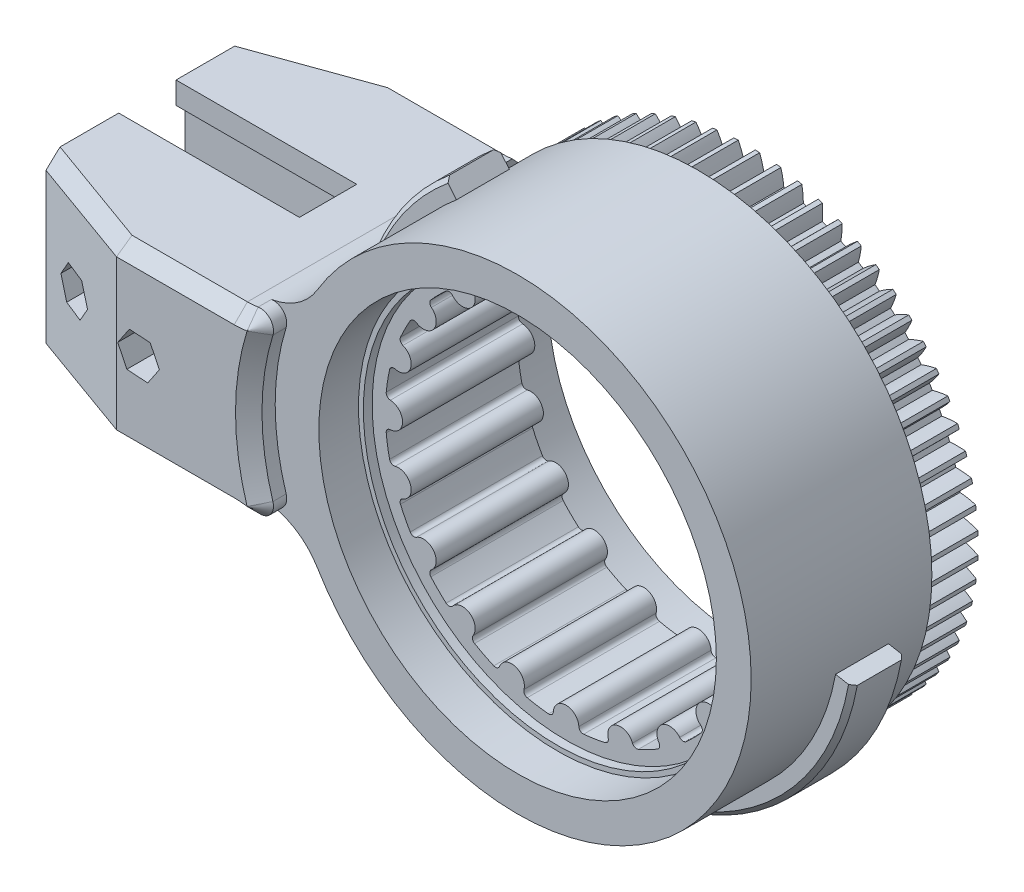
from build123d import *

# Parameters (mm, degrees)
SKETCH1_R            = 53
BOSS_EXTRUDE1_DEPTH  = 30
BOSS_EXTRUDE2_DEPTH  = 30
BOSS_EXTRUDE3_DEPTH  = 17
BOSS_EXTRUDE4_START  = 17
BOSS_EXTRUDE4_DEPTH  = 17
SKETCH7_W            = 82
SKETCH7_H            = 12.999999999999998
CUT_EXTRUDE3_DEPTH   = 141.13564856952
CUT_EXTRUDE4_DEPTH   = 141.13564856952
FILLET3_R            = 15
CUT_EXTRUDE5_DEPTH   = 41
SKETCH11_R           = 2.750000000000008
CUT_EXTRUDE6_DEPTH   = 138.85862323409444
SKETCH12_R           = 4.599999999999999
SKETCH12_R_2         = 4.600000000000013
CUT_EXTRUDE7_DEPTH   = 12
CUT_EXTRUDE8_DEPTH   = 12
FILLET5_R            = 3
SKETCH25_R           = 57.000000000000014
SKETCH25_R_2         = 53.00000000000001
BOSS_EXTRUDE8_DEPTH  = 6
CUT_EXTRUDE12_START  = -15
CUT_EXTRUDE12_DEPTH  = 15
CHAMFER4_SIZE        = 1
CUT_EXTRUDE13_DEPTH  = 133.5066036875144
FILLET6_R            = 1
BOSS_EXTRUDE9_DEPTH  = 17
SKETCH29_R           = 53.00000000000001
SKETCH29_R_2         = 44
BOSS_EXTRUDE10_DEPTH = 11
SKETCH30_R           = 45.1
CUT_EXTRUDE14_DEPTH  = 9
BOSS_EXTRUDE12_START = 11
SKETCH31_R           = 44
BOSS_EXTRUDE12_DEPTH = 11
CUT_EXTRUDE15_START  = -9
SKETCH32_R           = 45.1
CUT_EXTRUDE15_DEPTH  = 9
CUT_EXTRUDE16_DEPTH  = 87.00000000000003
CUT_EXTRUDE17_DEPTH  = 11
CHAMFER5_SIZE        = 3
CUT_EXTRUDE18_START  = -6
CUT_EXTRUDE18_DEPTH  = 6


# Read off the part's stored shape, not the designer's step: Cut-Extrude18
# Some blends are built 0.0001 mm under size
with BuildPart() as part:
    # Sketch1 → Boss-Extrude1 (new body)
    with BuildSketch(Plane.XY):
        Circle(SKETCH1_R)
    extrude(amount=BOSS_EXTRUDE1_DEPTH)

    # Sketch4 → Boss-Extrude2 (add)
    with BuildSketch(Plane(origin=(0, 0, 0), x_dir=(-1, 0, 0), z_dir=(0, 0, -1))):
        with BuildLine():
            Line((49.081564767232116, -19.999999999999993), (110, -19.999999999999993))
            Line((110, -19.999999999999993), (110, 20.000000000000007))
            Line((110, 20.000000000000007), (49.08156476723211, 20.000000000000007))
            ThreePointArc((49.08156476723211, 20.000000000000007), (53.00000000000001, 8.83e-15), (49.081564767232116, -19.999999999999993))
        make_face()
    extrude(amount=-BOSS_EXTRUDE2_DEPTH)

    # Sketch5 → Boss-Extrude3 (add)
    with BuildSketch(Plane(origin=(0, 0, 0), x_dir=(-1, 0, 0), z_dir=(0, 0, -1))):
        with BuildLine():
            Line((110, -20), (110, 20))
            Line((110, 20), (51.234753829797995, 20))
            ThreePointArc((51.234753829797995, 20), (55, 0), (51.234753829797995, -20))
            Line((51.234753829797995, -20), (110, -20))
        make_face()
    extrude(amount=BOSS_EXTRUDE3_DEPTH)

    # Sketch6 → Boss-Extrude4 (add)
    with BuildSketch(Plane.XY.offset(30).offset(BOSS_EXTRUDE4_START)):
        with BuildLine():
            Line((-110, -20), (-51.234753829797995, -20))
            ThreePointArc((-51.234753829797995, -20), (-54.99999999999999, 6.74e-15), (-51.23475382979798, 20.00000000000001))
            Line((-51.23475382979798, 20.00000000000001), (-110.00000000000001, 20))
            Line((-110.00000000000001, 20), (-110, -20))
        make_face()
    extrude(amount=-BOSS_EXTRUDE4_DEPTH)

    # Sketch7 → Cut-Extrude3 (cut, through all)
    with BuildSketch(Plane(origin=(0, 20.000000000000007, 0), x_dir=(1, -1.3e-16, 0), z_dir=(1.3e-16, 1, 0))):
        with Locations((-110, -15)):
            Rectangle(SKETCH7_W, SKETCH7_H)
    extrude(amount=-CUT_EXTRUDE3_DEPTH, mode=Mode.SUBTRACT)

    # Sketch8 → Cut-Extrude4 (cut, through all)
    with BuildSketch(Plane(origin=(0, 20.000000000000007, 0), x_dir=(1, -1.3e-16, 0), z_dir=(1.3e-16, 1, 0))):
        Polygon((-110, 7.999999999999993), (-84.99999999999999, 16.999999999999996), (-110, 17), align=None)
        Polygon((-110.00000000000001, -38), (-85.00000000000001, -47), (-110.00000000000001, -47), align=None)
    extrude(amount=-CUT_EXTRUDE4_DEPTH, mode=Mode.SUBTRACT)

    # Fillet3
    # the kernel refuses this fillet: 15 mm, written as the material it adds along each edge
    with BuildSketch(Plane(origin=(-49.0815647672321, 20.000000000000014, -23.048446553404), x_dir=(0.4473529357802653, 0.8943575072915626, 0), z_dir=(0, 0, 1))) as fillet3_piece_1_section:
        with BuildLine():
            CenterArc((9.291046517037513, 14.955714519282), FILLET3_R, 206.57397747208606, 59.02220221936807)
            Line((-4.1243160923359525, 8.245420482578071), (0, 0))
            ThreePointArc((0, 0), (4.0696319454792445, 0.15647536520358749), (8.139263890958485, 1e-16))
        make_face()
    fillet3_piece_1 = extrude(amount=53.048446553404, mode=Mode.PRIVATE)
    fillet3_piece_1 = split(fillet3_piece_1, bisect_by=Plane(origin=(-53.28116974823122, 20.422092874134577, 0), z_dir=(0, 0, -1)), keep=Keep.TOP, mode=Mode.PRIVATE)
    fillet3_piece_1 = split(fillet3_piece_1, bisect_by=Plane(origin=(-53.28116974823122, 20.422092874134577, -17), z_dir=(0, 0, 1)), keep=Keep.TOP, mode=Mode.PRIVATE)
    fillet3_piece_1 = fillet3_piece_1 - Plane(origin=(-4.619e-14, -8.9e-16, -8.500000000001432), x_dir=(-0.9315409787235998, 0.36363636363636387, 0), z_dir=(0, 0, 1)) * Cylinder(54.999999999999964, 140, mode=Mode.PRIVATE)
    add(fillet3_piece_1)
    with BuildSketch(Plane(origin=(-49.0815647672321, 20.000000000000004, 0), x_dir=(0.4473529357802649, 0.8943575072915632, 0), z_dir=(0, 0, 1))) as fillet3_piece_2_section:
        with BuildLine():
            CenterArc((9.291046517037534, 14.955714519282003), FILLET3_R, 206.57397747208603, 59.02220221936807)
            Line((-4.124316092335939, 8.245420482578082), (0, 0))
            ThreePointArc((0, 0), (4.069631945479255, 0.15647536520358993), (8.139263890958498, -1.8e-16))
        make_face()
    fillet3_piece_2 = extrude(amount=30, mode=Mode.PRIVATE)
    fillet3_piece_2 = fillet3_piece_2 & Plane(origin=(-4.619e-14, -8.9e-16, 15.000000000000005), x_dir=(-0.9315409787235998, 0.36363636363636387, 0), z_dir=(0, 0, 1)) * Cylinder(54.999999999999964, 93, mode=Mode.PRIVATE)
    add(fillet3_piece_2)
    with BuildSketch(Plane(origin=(-49.0815647672321, 20.000000000000004, 0), x_dir=(0.4473529357802649, 0.8943575072915632, 0), z_dir=(0, 0, 1))) as fillet3_piece_3_section:
        with BuildLine():
            CenterArc((9.291046517037534, 14.955714519282003), FILLET3_R, 206.57397747208603, 59.02220221936807)
            Line((-4.124316092335939, 8.245420482578082), (0, 0))
            ThreePointArc((0, 0), (4.069631945479255, 0.15647536520358993), (8.139263890958498, -1.8e-16))
        make_face()
    fillet3_piece_3 = extrude(amount=30, mode=Mode.PRIVATE)
    fillet3_piece_3 = fillet3_piece_3 - Plane(origin=(-4.619e-14, -8.9e-16, 15), x_dir=(-0.9315409787235998, 0.36363636363636387, 0), z_dir=(0, 0, 1)) * Cylinder(54.999999999999964, 93, mode=Mode.PRIVATE)
    add(fillet3_piece_3)
    with BuildSketch(Plane(origin=(-49.0815647672321, 20.000000000000004, 0), x_dir=(0.4473529357802649, 0.8943575072915632, 0), z_dir=(0, 0, 1))) as fillet3_piece_4_section:
        with BuildLine():
            CenterArc((9.291046517037534, 14.955714519282003), FILLET3_R, 206.57397747208603, 59.02220221936807)
            Line((-4.124316092335939, 8.245420482578082), (0, 0))
            ThreePointArc((0, 0), (4.069631945479255, 0.15647536520358993), (8.139263890958498, -1.8e-16))
        make_face()
    fillet3_piece_4 = extrude(amount=53.04844655340399, mode=Mode.PRIVATE)
    fillet3_piece_4 = split(fillet3_piece_4, bisect_by=Plane(origin=(-53.28116974823098, 20.422092874134677, 30), z_dir=(0, 0, 1)), keep=Keep.TOP, mode=Mode.PRIVATE)
    fillet3_piece_4 = split(fillet3_piece_4, bisect_by=Plane(origin=(-53.28116974823098, 20.422092874134677, 47), z_dir=(0, 0, -1)), keep=Keep.TOP, mode=Mode.PRIVATE)
    fillet3_piece_4 = fillet3_piece_4 - Plane(origin=(-4.619e-14, -8.9e-16, 38.5), x_dir=(-0.9315409787235998, 0.36363636363636387, 0), z_dir=(0, 0, 1)) * Cylinder(54.999999999999964, 140, mode=Mode.PRIVATE)
    add(fillet3_piece_4)
    with BuildSketch(Plane(origin=(-49.0815647672321, -20, -23.048446553404016), x_dir=(0.44735293578026375, -0.8943575072915635, 0), z_dir=(0, 0, 1))) as fillet3_piece_5_section:
        with BuildLine():
            CenterArc((9.291046517037518, -14.955714519281996), FILLET3_R, 94.40382030854599, 59.022202219367955)
            Line((-4.12431609233595, -8.245420482578071), (0, 0))
            ThreePointArc((0, 0), (4.06963194547922, -0.15647536520359132), (8.139263890958468, 4.4e-16))
        make_face()
    fillet3_piece_5 = extrude(amount=53.04844655340402, mode=Mode.PRIVATE)
    fillet3_piece_5 = split(fillet3_piece_5, bisect_by=Plane(origin=(-53.281169748231235, -20.422092874134563, 0), z_dir=(0, 0, -1)), keep=Keep.TOP, mode=Mode.PRIVATE)
    fillet3_piece_5 = fillet3_piece_5 - Plane(origin=(-4.619e-14, -8.9e-16, -8.50000000000143), x_dir=(-0.9315409787235998, 0.36363636363636387, 0), z_dir=(0, 0, 1)) * Cylinder(54.999999999999964, 140, mode=Mode.PRIVATE)
    fillet3_piece_5 = split(fillet3_piece_5, bisect_by=Plane(origin=(-53.281169748231235, -20.422092874134563, -17), z_dir=(0, 0, 1)), keep=Keep.TOP, mode=Mode.PRIVATE)
    add(fillet3_piece_5)
    with BuildSketch(Plane(origin=(-49.08156476723211, -19.999999999999993, 0), x_dir=(0.44735293578026414, -0.8943575072915634, 0), z_dir=(0, 0, 1))) as fillet3_piece_6_section:
        with BuildLine():
            CenterArc((9.291046517037522, -14.955714519281997), FILLET3_R, 94.40382030854596, 59.02220221936801)
            Line((-4.124316092335951, -8.24542048257808), (0, 0))
            ThreePointArc((0, 0), (4.069631945479229, -0.15647536520358973), (8.139263890958478, 2.1e-16))
        make_face()
    fillet3_piece_6 = extrude(amount=30, mode=Mode.PRIVATE)
    fillet3_piece_6 = fillet3_piece_6 & Plane(origin=(-4.619e-14, -8.9e-16, 15.000000000000002), x_dir=(-0.9315409787235998, 0.36363636363636387, 0), z_dir=(0, 0, 1)) * Cylinder(54.999999999999964, 93, mode=Mode.PRIVATE)
    add(fillet3_piece_6)
    with BuildSketch(Plane(origin=(-49.08156476723211, -19.999999999999993, 0), x_dir=(0.44735293578026414, -0.8943575072915634, 0), z_dir=(0, 0, 1))) as fillet3_piece_7_section:
        with BuildLine():
            CenterArc((9.291046517037522, -14.955714519281997), FILLET3_R, 94.40382030854596, 59.02220221936801)
            Line((-4.124316092335951, -8.24542048257808), (0, 0))
            ThreePointArc((0, 0), (4.069631945479229, -0.15647536520358973), (8.139263890958478, 2.1e-16))
        make_face()
    fillet3_piece_7 = extrude(amount=30, mode=Mode.PRIVATE)
    fillet3_piece_7 = fillet3_piece_7 - Plane(origin=(-4.619e-14, -8.9e-16, 15.000000000000004), x_dir=(-0.9315409787235998, 0.36363636363636387, 0), z_dir=(0, 0, 1)) * Cylinder(54.999999999999964, 93, mode=Mode.PRIVATE)
    add(fillet3_piece_7)
    with BuildSketch(Plane(origin=(-49.08156476723211, -19.999999999999993, 0), x_dir=(0.44735293578026414, -0.8943575072915634, 0), z_dir=(0, 0, 1))) as fillet3_piece_8_section:
        with BuildLine():
            CenterArc((9.291046517037522, -14.955714519281997), FILLET3_R, 94.40382030854596, 59.02220221936801)
            Line((-4.124316092335951, -8.24542048257808), (0, 0))
            ThreePointArc((0, 0), (4.069631945479229, -0.15647536520358973), (8.139263890958478, 2.1e-16))
        make_face()
    fillet3_piece_8 = extrude(amount=53.04844655340402, mode=Mode.PRIVATE)
    fillet3_piece_8 = split(fillet3_piece_8, bisect_by=Plane(origin=(-53.281169748231, -20.422092874134673, 30), z_dir=(0, 0, 1)), keep=Keep.TOP, mode=Mode.PRIVATE)
    fillet3_piece_8 = fillet3_piece_8 - Plane(origin=(-4.619e-14, -8.9e-16, 38.50000000000001), x_dir=(-0.9315409787235998, 0.36363636363636387, 0), z_dir=(0, 0, 1)) * Cylinder(54.999999999999964, 140, mode=Mode.PRIVATE)
    fillet3_piece_8 = split(fillet3_piece_8, bisect_by=Plane(origin=(-53.281169748231, -20.422092874134673, 47), z_dir=(0, 0, -1)), keep=Keep.TOP, mode=Mode.PRIVATE)
    add(fillet3_piece_8)

    # Sketch10 → Cut-Extrude5 (cut)
    with BuildSketch(Plane.ZY.offset(110)):
        Polygon((6.500000000000009, 15.000000000000007), (23.499999999999993, 15.000000000000005), (23.499999999999993, -14.999999999999998), (6.500000000000009, -14.999999999999995), align=None)
    extrude(amount=-CUT_EXTRUDE5_DEPTH, mode=Mode.SUBTRACT)

    # Sketch11 → Cut-Extrude6 (cut, through all)
    with BuildSketch(Plane(origin=(0, 0, -17), x_dir=(-1, 0, 0), z_dir=(0, 0, -1))):
        with Locations((100.00000000000001, -3.67e-15)):
            Circle(SKETCH11_R)
        with Locations((80.00000000000001, -6.12e-15)):
            Circle(SKETCH11_R)
    extrude(amount=-CUT_EXTRUDE6_DEPTH, mode=Mode.SUBTRACT)

    # Sketch12 → Cut-Extrude7 (cut)
    with BuildSketch(Plane(origin=(0, 0, -17), x_dir=(-1, 0, 0), z_dir=(0, 0, -1))):
        with Locations((80.00000000000001, -6.12e-15)):
            Circle(SKETCH12_R)
        with Locations((100.00000000000001, -3.67e-15)):
            Circle(SKETCH12_R_2)
    extrude(amount=-CUT_EXTRUDE7_DEPTH, mode=Mode.SUBTRACT)

    # Sketch13 → Cut-Extrude8 (cut)
    with BuildSketch(Plane.XY.offset(47)):
        Polygon((-104.72243583501142, 0.3345640708945011), (-102.6509589020939, -3.9224673654145996), (-97.92852306708248, -4.25703143630911), (-95.2775641649886, -0.33456407089451756), (-97.34904109790612, 3.922467365414598), (-102.07147693291755, 4.257031436309093), align=None)
        Polygon((-84.72243583501141, 0.3345640708945193), (-82.6509589020939, -3.9224673654145708), (-77.92852306708252, -4.257031436309093), (-75.27756416498863, -0.3345640708945236), (-77.34904109790615, 3.922467365414575), (-82.07147693291752, 4.257031436309095), align=None)
    extrude(amount=-CUT_EXTRUDE8_DEPTH, mode=Mode.SUBTRACT)

    # Fillet5
    fillet5_edges = [part.edges().sort_by_distance(p)[0] for p in [
        (-50.25966902236701, 22.33753947421521, 38.5),
        (-50.25966902236701, -22.33753947421521, -8.5),
        (-50.25966902236701, -22.33753947421521, 38.5),
        (-50.25966902236701, 22.33753947421521, -8.5),
    ]]
    fillet(fillet5_edges, radius=FILLET5_R)

    # Sketch25 → Boss-Extrude8 (add, symmetric)
    with BuildSketch(Plane.XY.offset(15)):
        Circle(SKETCH25_R)
        Circle(SKETCH25_R_2, mode=Mode.SUBTRACT)
    extrude(amount=BOSS_EXTRUDE8_DEPTH, both=True)

    # Sketch26 → Cut-Extrude12 (cut)
    with BuildSketch(Plane.XY.offset(20.999999999999996).offset(CUT_EXTRUDE12_START)):
        with BuildLine():
            Line((56.08608475584366, -10.16617414568147), (52.15021915894235, -9.452758416159961))
            ThreePointArc((52.15021915894235, -9.452758416159961), (26.71911276094378, 45.77214232770815), (-33.873269606877095, 40.76274777465102))
            Line((-33.873269606877095, 40.76274777465102), (-36.429742784754616, 43.83918156896431))
            ThreePointArc((-36.429742784754616, 43.83918156896431), (28.735649573090477, 49.22664363545971), (56.08608475584366, -10.16617414568147))
        make_face()
    extrude(amount=CUT_EXTRUDE12_DEPTH, mode=Mode.SUBTRACT)

    # Chamfer4
    chamfer4_edges = [part.edges().sort_by_distance(p)[0] for p in [
        (5.61573401269491, -56.72268974139594, 21),
        (5.615734012695087, -56.72268974139592, 9),
        (-46.15606788175347, 33.445738109585335, 9),
        (-46.15606788175364, 33.44573810958507, 21),
    ]]
    chamfer(chamfer4_edges, length=CHAMFER4_SIZE)

    # Sketch27 → Cut-Extrude13 (cut, through all)
    with BuildSketch(Plane.XY.offset(30)):
        with BuildLine():
            ThreePointArc((-40.907375, 2.7543911503951275), (-37.1, 0), (-40.907375, -2.754391150395128))
            ThreePointArc((-40.90737500000001, -2.7543911503951284), (-40.4952219644007, -6.413813066649193), (-39.75637923290765, -10.021492418259339))
            ThreePointArc((-39.756379232907655, -10.021492418259337), (-35.284196754550344, -11.464530491310063), (-38.05407188365161, -15.260655722277335))
            ThreePointArc((-38.054071883651616, -15.260655722277338), (-36.531267491723334, -18.613610489320937), (-34.7137520675163, -21.816402485171746))
            ThreePointArc((-34.71375206751631, -21.816402485171754), (-30.014530491310836, -21.80683286005037), (-31.47577107302206, -26.273100984823028))
            ThreePointArc((-31.475771073022045, -26.273100984823024), (-28.991378028648818, -28.991378028648086), (-26.273100984823817, -31.47577107302139))
            ThreePointArc((-26.273100984823817, -31.475771073021395), (-21.806832860051127, -30.014530491310282), (-21.81640248517262, -34.71375206751575))
            ThreePointArc((-21.81640248517262, -34.71375206751575), (-18.61361048932185, -36.53126749172287), (-15.260655722278287, -38.05407188365124))
            ThreePointArc((-15.260655722278294, -38.05407188365123), (-11.46453049131095, -35.28419675455007), (-10.021492418260337, -39.75637923290741))
            ThreePointArc((-10.021492418260333, -39.756379232907406), (-6.4138130666499125, -40.49522196440058), (-2.754391150395566, -40.90737499999997))
            ThreePointArc((-2.75439115039557, -40.90737499999997), (-4.0135e-13, -37.099999999999994), (2.7543911503946816, -40.90737500000004))
            ThreePointArc((2.7543911503946847, -40.90737500000004), (6.413813066649044, -40.49522196440073), (10.021492418259474, -39.75637923290762))
            ThreePointArc((10.021492418259468, -39.75637923290762), (11.464530491310187, -35.28419675455032), (15.26065572227747, -38.05407188365156))
            ThreePointArc((15.260655722277473, -38.05407188365156), (18.613610489321065, -36.53126749172327), (21.81640248517186, -34.713752067516225))
            ThreePointArc((21.816402485171857, -34.713752067516225), (21.806832860050473, -30.014530491310765), (26.27310098482313, -31.475771073021956))
            ThreePointArc((26.27310098482313, -31.47577107302196), (28.991378028648192, -28.991378028648704), (31.47577107302149, -26.2731009848237))
            ThreePointArc((31.47577107302149, -26.273100984823703), (30.014530491310367, -21.80683286005101), (34.71375206751584, -21.81640248517249))
            ThreePointArc((34.71375206751584, -21.816402485172496), (36.53126749172293, -18.613610489321715), (38.05407188365129, -15.260655722278159))
            ThreePointArc((38.05407188365129, -15.260655722278155), (35.284196754550095, -11.464530491310827), (39.756379232907435, -10.021492418260186))
            ThreePointArc((39.75637923290745, -10.021492418260188), (40.49522196440061, -6.413813066649775), (40.90737499999999, -2.754391150395428))
            ThreePointArc((40.90737499999998, -2.7543911503954317), (37.10000000000001, -2.7522e-13), (40.90737500000002, 2.754391150394826))
            ThreePointArc((40.90737500000002, 2.7543911503948304), (40.49522196440069, 6.4138130666491975), (39.75637923290758, 10.02149241825964))
            ThreePointArc((39.756379232907584, 10.021492418259637), (35.28419675455027, 11.46453049131034), (38.05407188365151, 15.26065572227763))
            ThreePointArc((38.05407188365152, 15.260655722277631), (36.53126749172334, 18.613610489320955), (34.713752067516474, 21.816402485171515))
            ThreePointArc((34.71375206751647, 21.816402485171512), (30.014530491310992, 21.806832860050168), (31.47577107302224, 26.27310098482282))
            ThreePointArc((31.47577107302224, 26.27310098482282), (28.99137802864902, 28.9913780286479), (26.27310098482403, 31.475771073021225))
            ThreePointArc((26.273100984824023, 31.47577107302122), (21.80683286005131, 30.014530491310136), (21.816402485172837, 34.71375206751562))
            ThreePointArc((21.816402485172837, 34.71375206751562), (18.61361048932209, 36.531267491722744), (15.260655722278551, 38.054071883651126))
            ThreePointArc((15.260655722278553, 38.05407188365113), (11.464530491311193, 35.284196754549995), (10.021492418260602, 39.75637923290734))
            ThreePointArc((10.0214924182606, 39.756379232907335), (6.4138130666501825, 40.49522196440053), (2.75439115039583, 40.907374999999945))
            ThreePointArc((2.754391150395825, 40.907374999999945), (6.2539e-13, 37.1), (-2.754391150394434, 40.907375000000044))
            ThreePointArc((-2.7543911503944294, 40.907375000000044), (-6.413813066648778, 40.495221964400756), (-10.021492418259205, 39.75637923290769))
            ThreePointArc((-10.021492418259205, 39.75637923290769), (-11.464530491309949, 35.28419675455039), (-15.260655722277214, 38.05407188365166))
            ThreePointArc((-15.260655722277214, 38.05407188365166), (-18.613610489320806, 36.53126749172338), (-21.816402485171615, 34.71375206751638))
            ThreePointArc((-21.816402485171615, 34.71375206751638), (-21.80683286005026, 30.01453049131091), (-26.27310098482291, 31.475771073022152))
            ThreePointArc((-26.27310098482291, 31.47577107302215), (-28.991378028647986, 28.991378028648917), (-31.4757710730213, 26.27310098482392))
            ThreePointArc((-31.475771073021303, 26.273100984823916), (-30.014530491310225, 21.806832860051234), (-34.71375206751568, 21.816402485172727))
            ThreePointArc((-34.713752067515685, 21.81640248517273), (-36.53126749172281, 18.61361048932197), (-38.05407188365121, 15.260655722278418))
            ThreePointArc((-38.054071883651204, 15.260655722278411), (-35.284196754550045, 11.46453049131107), (-39.756379232907385, 10.02149241826046))
            ThreePointArc((-39.75637923290738, 10.021492418260458), (-40.4952219644006, 6.413813066649761), (-40.907375, 2.754391150395126))
        make_face()
    extrude(amount=-CUT_EXTRUDE13_DEPTH, mode=Mode.SUBTRACT)

    # Fillet6
    fillet6_edges = [part.edges().sort_by_distance(p)[0] for p in [
        (-38.054071883651616, -15.260655722277338, 15),
        (-39.75637923290765, -10.021492418259339, 15),
        (-40.907375, -2.7543911503951275, 15),
        (-40.90737500000001, 2.7543911503951266, 15),
        (-39.756379232907385, 10.021492418260458, 15),
        (-38.054071883651204, 15.260655722278415, 15),
        (-34.71375206751568, 21.816402485172727, 15),
        (-31.4757710730213, 26.27310098482392, 15),
        (-26.27310098482291, 31.47577107302215, 15),
        (-21.81640248517162, 34.71375206751638, 15),
        (-15.260655722277214, 38.05407188365166, 15),
        (-10.021492418259207, 39.75637923290769, 15),
        (-2.754391150394434, 40.907375000000044, 15),
        (2.7543911503958247, 40.907374999999945, 15),
        (10.0214924182606, 39.75637923290734, 15),
        (15.260655722278553, 38.05407188365113, 15),
        (21.816402485172837, 34.71375206751563, 15),
        (26.273100984824033, 31.475771073021225, 15),
        (31.475771073022244, 26.27310098482282, 15),
        (34.71375206751647, 21.816402485171515, 15),
        (38.05407188365152, 15.260655722277633, 15),
        (39.75637923290759, 10.02149241825964, 15),
        (40.90737500000003, 2.754391150394827, 15),
        (40.90737499999999, -2.754391150395432, 15),
        (39.75637923290744, -10.021492418260186, 15),
        (38.05407188365129, -15.260655722278159, 15),
        (34.71375206751584, -21.816402485172496, 15),
        (31.475771073021495, -26.273100984823706, 15),
        (26.273100984823134, -31.47577107302196, 15),
        (21.816402485171857, -34.713752067516225, 15),
        (15.260655722277471, -38.05407188365156, 15),
        (10.02149241825947, -39.75637923290761, 15),
        (2.7543911503946816, -40.90737500000003, 15),
        (-2.754391150395568, -40.90737499999997, 15),
        (-10.021492418260333, -39.756379232907406, 15),
        (-15.26065572227829, -38.05407188365124, 15),
        (-21.816402485172624, -34.713752067515756, 15),
        (-26.273100984823817, -31.47577107302139, 15),
        (-31.475771073022052, -26.273100984823024, 15),
        (-34.71375206751631, -21.816402485171754, 15),
    ]]
    fillet(fillet6_edges, radius=FILLET6_R)

    # Sketch28 → Boss-Extrude9 (add)
    with BuildSketch(Plane.XY.offset(30)):
        with BuildLine():
            ThreePointArc((-45.4404411705215, 27.279411764705895), (-53, 6.49e-15), (-45.440441170521524, -27.279411764705866))
            ThreePointArc((-45.440441170521524, -27.279411764705866), (-49.873523577145335, -22.591188803047693), (-55.865927881855164, -20.198962891677358))
            ThreePointArc((-55.865927881855164, -20.198962891677358), (-53.11568452002121, -19.207954170833595), (-52.514497636688105, -16.347095704322484))
            ThreePointArc((-52.514497636688105, -16.347095704322484), (-54.99999999999999, 3.116e-14), (-52.514497636688084, 16.347095704322545))
            ThreePointArc((-52.514497636688084, 16.347095704322545), (-53.115684520021205, 19.20795417083364), (-55.86592788185514, 20.198962891677386))
            ThreePointArc((-55.86592788185514, 20.198962891677386), (-49.87352357714531, 22.591188803047718), (-45.4404411705215, 27.279411764705895))
        make_face()
    extrude(amount=BOSS_EXTRUDE9_DEPTH)

    # Sketch29 → Boss-Extrude10 (add)
    with BuildSketch(Plane.XY.offset(30)):
        Circle(SKETCH29_R)
        Circle(SKETCH29_R_2, mode=Mode.SUBTRACT)
    extrude(amount=BOSS_EXTRUDE10_DEPTH)

    # Sketch30 → Cut-Extrude14 (cut)
    with BuildSketch(Plane.XY.offset(40.99999999999999)):
        Circle(SKETCH30_R)
    extrude(amount=-CUT_EXTRUDE14_DEPTH, mode=Mode.SUBTRACT)

    # Sketch31 → Boss-Extrude12 (add)
    with BuildSketch(Plane(origin=(0, 0, 0), x_dir=(-1, 0, 0), z_dir=(0, 0, -1)).offset(BOSS_EXTRUDE12_START)):
        with BuildLine():
            ThreePointArc((52.5144976366881, -16.34709570432253), (55, 1.832e-14), (52.514497636688084, 16.347095704322566))
            ThreePointArc((52.514497636688084, 16.347095704322566), (53.11568452002122, 19.207954170833652), (55.86592788185514, 20.198962891677393))
            ThreePointArc((55.86592788185514, 20.198962891677393), (49.87352357714532, 22.59118880304772), (45.44044117052151, 27.27941176470589))
            ThreePointArc((45.44044117052151, 27.27941176470589), (-53.00000000000001, 6.49e-15), (45.44044117052153, -27.279411764705866))
            ThreePointArc((45.44044117052153, -27.279411764705866), (49.873523577145335, -22.591188803047693), (55.86592788185516, -20.198962891677365))
            ThreePointArc((55.86592788185516, -20.198962891677365), (53.11568452002122, -19.20795417083363), (52.5144976366881, -16.34709570432253))
        make_face()
        with Locations(Location((0, 0, 0), (0, 0, 180))):
            Circle(SKETCH31_R, mode=Mode.SUBTRACT)
    extrude(amount=-BOSS_EXTRUDE12_DEPTH)

    # Sketch32 → Cut-Extrude15 (cut)
    with BuildSketch(Plane(origin=(0, 0, -11), x_dir=(-1, 0, 0), z_dir=(0, 0, -1)).offset(CUT_EXTRUDE15_START)):
        with Locations(Location((0, 0, 0), (0, 0, 180))):
            Circle(SKETCH32_R)
    extrude(amount=CUT_EXTRUDE15_DEPTH, mode=Mode.SUBTRACT)

    # Sketch33 → Cut-Extrude16 (cut)
    with BuildSketch(Plane.XY.offset(40.99999999999999)):
        with BuildLine():
            ThreePointArc((-55.86592788185516, -20.19896289167738), (-53.115684520021226, -19.207954170833624), (-52.51449763668811, -16.34709570432253))
            ThreePointArc((-52.51449763668811, -16.34709570432253), (-55, 3.116e-14), (-52.514497636688084, 16.34709570432257))
            ThreePointArc((-52.514497636688084, 16.34709570432257), (-53.11568452002121, 19.207954170833652), (-55.86592788185514, 20.198962891677397))
            ThreePointArc((-55.86592788185514, 20.198962891677397), (-49.87352357714532, 22.591188803047725), (-45.44044117052151, 27.27941176470589))
            ThreePointArc((-45.44044117052151, 27.27941176470589), (53.00000000000001, -2.354e-14), (-45.44044117052154, -27.27941176470585))
            ThreePointArc((-45.44044117052154, -27.27941176470585), (-49.87352357714534, -22.591188803047693), (-55.86592788185516, -20.19896289167738))
        make_face()
    extrude(amount=CUT_EXTRUDE16_DEPTH, mode=Mode.SUBTRACT)

    # Sketch34 → Cut-Extrude17 (cut)
    with BuildSketch(Plane(origin=(0, 0, -11), x_dir=(-1, 0, 0), z_dir=(0, 0, -1))):
        with BuildLine():
            Line((43.590254707958856, -29.258162516655386), (46.73312958921158, -25.450880464523124))
            Line((46.73312958921158, -25.450880464523124), (28.203988954095173, -92.78721130401283))
            Line((28.203988954095173, -92.78721130401283), (-81.3352654843022, -44.682998821940124))
            Line((-81.3352654843022, -44.682998821940124), (-81.3352654843022, 38.068857344704995))
            Line((-81.3352654843022, 38.068857344704995), (11.535372874828195, 66.47412561321472))
            Line((11.535372874828195, 66.47412561321472), (65.30054985015268, 45.62215956503212))
            Line((65.30054985015268, 45.62215956503212), (46.58818372455529, 25.629233699826006))
            Line((46.58818372455529, 25.629233699826006), (43.028780236197115, 30.078222850873885))
            ThreePointArc((43.028780236197115, 30.078222850873885), (41.2821108489121, 29.66394294236604), (39.578623868683025, 29.09771516199677))
            ThreePointArc((39.578623868683025, 29.09771516199677), (39.20106299147237, 29.604430845284078), (38.81701529208052, 30.10624790784894))
            ThreePointArc((38.81701529208052, 30.10624790784894), (39.82800863599398, 31.589869062776344), (40.70464456929483, 33.15663283349329))
            ThreePointArc((40.70464456929483, 33.15663283349329), (40.38929819515906, 33.54006426451743), (40.07034015708169, 33.92049660794217))
            ThreePointArc((40.07034015708169, 33.92049660794217), (38.369172086862896, 33.346679154692886), (36.72504286198743, 32.62551456550689))
            ThreePointArc((36.72504286198743, 32.62551456550689), (36.30233876810561, 33.09523176628301), (35.87362751138009, 33.55947271454827))
            ThreePointArc((35.87362751138009, 33.55947271454827), (36.74341684589132, 35.13004770045501), (37.471750482056684, 36.771013692550994))
            ThreePointArc((37.471750482056684, 36.771013692550994), (37.12237073085171, 37.12371298008325), (36.76967144331946, 37.47309273128822))
            ThreePointArc((36.76967144331946, 37.47309273128822), (35.12870545122347, 36.744759095122895), (33.558130465316715, 35.87496976061169))
            ThreePointArc((33.558130465316715, 35.87496976061169), (33.09388951705146, 36.3036810173372), (32.624172316275356, 36.72638511121904))
            ThreePointArc((32.624172316275356, 36.72638511121904), (33.345336905461394, 38.3705143360945), (33.9191543587107, 40.07168240631329))
            ThreePointArc((33.9191543587107, 40.07168240631329), (33.53872201528597, 40.390640444390684), (33.155290584261834, 40.70598681852646))
            ThreePointArc((33.155290584261834, 40.70598681852646), (31.58852681354488, 39.82935088522565), (30.104905658617458, 38.81835754131222))
            ThreePointArc((30.104905658617458, 38.81835754131222), (29.603088596052604, 39.20240524070408), (29.09637291276531, 39.579966117914736))
            ThreePointArc((29.09637291276531, 39.579966117914736), (29.66276003462668, 41.283622450915914), (30.077165696771154, 43.03047883309735))
            ThreePointArc((30.077165696771154, 43.03047883309735), (29.668926475744097, 43.31297438420046), (29.258034203003415, 43.591596957190916))
            ThreePointArc((29.258034203003415, 43.591596957190916), (27.778839729731907, 42.57413787544441), (26.394830138367574, 41.43056596087279))
            ThreePointArc((26.394830138367574, 41.43056596087279), (25.85971828774522, 41.76667354337119), (25.320327241493615, 42.09586998763055))
            ThreePointArc((25.320327241493615, 42.09586998763055), (25.727104680809074, 43.844518433616585), (25.97856298885463, 45.62215956503212))
            ThreePointArc((25.97856298885463, 45.62215956503212), (25.545999843317983, 45.86578247672403), (25.111152316855282, 46.10530413901595))
            ThreePointArc((25.111152316855282, 46.10530413901595), (23.732147106725904, 44.955702510963235), (22.459556960770154, 43.689308578096494))
            ThreePointArc((22.459556960770154, 43.689308578096494), (21.895715707724687, 43.97460849231576), (21.328251192731475, 44.25263191563277))
            ThreePointArc((21.328251192731475, 44.25263191563277), (21.571948467814472, 46.03135362261859), (21.658314068138555, 47.82461329591359))
            ThreePointArc((21.658314068138555, 47.82461329591359), (21.20511747433255, 48.02728506341078), (20.750024659920687, 48.225662300634454))
            ThreePointArc((20.750024659920687, 48.225662300634454), (19.482973899162708, 46.95372612202797), (18.33266048903817, 45.57531459738336))
            ThreePointArc((18.33266048903817, 45.57531459738336), (17.744900328335753, 45.807372765049294), (17.154203751760484, 46.03185116960451))
            ThreePointArc((17.154203751760484, 46.03185116960451), (17.232741723385253, 47.82547071114573), (17.153277775137553, 49.6190494670732))
            ThreePointArc((17.153277775137553, 49.6190494670732), (16.683314246607914, 49.77904096631543), (16.211858835678235, 49.93458129382872))
            ThreePointArc((16.211858835678235, 49.93458129382872), (15.067572554632935, 48.551162275672276), (14.04934994876571, 47.072493280363865))
            ThreePointArc((14.04934994876571, 47.072493280363865), (13.442685442859064, 47.24932986301133), (12.833796419619347, 47.41834807820596))
            ThreePointArc((12.833796419619347, 47.41834807820596), (12.746505029503691, 49.21156292478656), (12.501889491072452, 50.99015858179897))
            ThreePointArc((12.501889491072452, 50.99015858179897), (12.019168590940124, 51.106104821726134), (11.535372874828195, 51.217481224296655))
            ThreePointArc((11.535372874828195, 51.217481224296655), (10.523613720581473, 49.734382209873345), (9.646169035229642, 48.1680712264051))
            ThreePointArc((9.646169035229642, 48.1680712264051), (9.02577603177928, 48.28817751666178), (8.403889388333159, 48.400293538677914))
            ThreePointArc((8.403889388333159, 48.400293538677914), (8.151513375839466, 50.17780461349665), (7.7438332207495835, 51.92624282056355))
            ThreePointArc((7.7438332207495835, 51.92624282056355), (7.252473353531909, 51.99715458873807), (6.760464906706024, 52.06341684216931))
            ThreePointArc((6.760464906706024, 52.06341684216931), (5.889864851625674, 50.49329110934421), (5.1606841354663855, 48.85270135076138))
            ThreePointArc((5.1606841354663855, 48.85270135076138), (4.531855608833329, 48.91505264410709), (3.9022770627516388, 48.96930993857589))
            ThreePointArc((3.9022770627516388, 48.96930993857589), (3.486969611033235, 50.715952143875136), (2.9197030226239566, 52.41931584269579))
            ThreePointArc((2.9197030226239566, 52.41931584269579), (2.4238962974594225, 52.444588144914384), (1.9278727625106105, 52.465170923023486))
            ThreePointArc((1.9278727625106105, 52.465170923023486), (1.2058594593016565, 50.82141423093832), (0.6311638251032947, 49.12054263060548))
            ThreePointArc((0.6311638251032947, 49.12054263060548), (-0.00073528144191609, 49.124606967789845), (-0.6326343879871327, 49.120542630605485))
            ThreePointArc((-0.6326343879871327, 49.120542630605485), (-1.2073300221854737, 50.82141423093833), (-1.9293433253944052, 52.46517092302349))
            ThreePointArc((-1.9293433253944052, 52.46517092302349), (-2.4253668603432263, 52.444588144914405), (-2.921173585507757, 52.419315842695816))
            ThreePointArc((-2.921173585507757, 52.419315842695816), (-3.488440173917059, 50.71595214387518), (-3.9037476256354897, 48.96930993857595))
            ThreePointArc((-3.9037476256354897, 48.96930993857595), (-4.53332617171716, 48.915052644107156), (-5.162154698350231, 48.85270135076146))
            ThreePointArc((-5.162154698350231, 48.85270135076146), (-5.891335414509502, 50.49329110934429), (-6.761935469589815, 52.063416842169396))
            ThreePointArc((-6.761935469589815, 52.063416842169396), (-7.253943916415684, 51.99715458873816), (-7.745303783633358, 51.92624282056366))
            ThreePointArc((-7.745303783633358, 51.92624282056366), (-8.152983938723265, 50.17780461349676), (-8.405359951216976, 48.400293538678035))
            ThreePointArc((-8.405359951216976, 48.400293538678035), (-9.027246594663081, 48.288177516661904), (-9.647639598113432, 48.16807122640523))
            ThreePointArc((-9.647639598113432, 48.16807122640523), (-10.525084283465237, 49.73438220987349), (-11.536843437711946, 51.21748122429681))
            ThreePointArc((-11.536843437711946, 51.21748122429681), (-12.020639153823884, 51.10610482172629), (-12.503360053956216, 50.99015858179914))
            ThreePointArc((-12.503360053956216, 50.99015858179914), (-12.747975592387473, 49.21156292478674), (-12.835266982503157, 47.41834807820614))
            ThreePointArc((-12.835266982503157, 47.41834807820614), (-13.44415600574287, 47.249329863011525), (-14.050820511649524, 47.07249328036405))
            ThreePointArc((-14.050820511649524, 47.07249328036405), (-15.069043117516728, 48.551162275672475), (-16.213329398562013, 49.93458129382894))
            ThreePointArc((-16.213329398562013, 49.93458129382894), (-16.684784809491678, 49.77904096631567), (-17.154748338021314, 49.61904946707344))
            ThreePointArc((-17.154748338021314, 49.61904946707344), (-17.23421228626904, 47.82547071114597), (-17.155674314644298, 46.03185116960475))
            ThreePointArc((-17.155674314644298, 46.03185116960475), (-17.74637089121956, 45.807372765049536), (-18.334131051921958, 45.575314597383624))
            ThreePointArc((-18.334131051921958, 45.575314597383624), (-19.484444462046483, 46.95372612202826), (-20.751495222804447, 48.22566230063476))
            ThreePointArc((-20.751495222804447, 48.22566230063476), (-21.20658803721632, 48.027285063411085), (-21.659784631022347, 47.82461329591392))
            ThreePointArc((-21.659784631022347, 47.82461329591392), (-21.57341903069829, 46.031353622618916), (-21.329721755615314, 44.252631915633096))
            ThreePointArc((-21.329721755615314, 44.252631915633096), (-21.89718627060855, 43.974608492316094), (-22.461027523653996, 43.689308578096835))
            ThreePointArc((-22.461027523653996, 43.689308578096835), (-23.733617669609743, 44.95570251096361), (-25.11262287973912, 46.10530413901635))
            ThreePointArc((-25.11262287973912, 46.10530413901635), (-25.5474704062018, 45.86578247672444), (-25.98003355173844, 45.62215956503254))
            ThreePointArc((-25.98003355173844, 45.62215956503254), (-25.728575243692912, 43.844518433617), (-25.32179780437747, 42.09586998763094))
            ThreePointArc((-25.32179780437747, 42.09586998763094), (-25.86118885062906, 41.76667354337162), (-26.396300701251405, 41.430565960873224))
            ThreePointArc((-26.396300701251405, 41.430565960873224), (-27.78031029261573, 42.574137875444855), (-29.259504765887232, 43.59159695719139))
            ThreePointArc((-29.259504765887232, 43.59159695719139), (-29.670397038627893, 43.312974384200956), (-30.07863625965494, 43.03047883309786))
            ThreePointArc((-30.07863625965494, 43.03047883309786), (-29.66423059751048, 41.283622450916404), (-29.097843475649135, 39.579966117915205))
            ThreePointArc((-29.097843475649135, 39.579966117915205), (-29.604559158936453, 39.20240524070454), (-30.10637622150129, 38.8183575413127))
            ThreePointArc((-30.10637622150129, 38.8183575413127), (-31.5899973764287, 39.829350885226155), (-33.15676114714565, 40.705986818526995))
            ThreePointArc((-33.15676114714565, 40.705986818526995), (-33.54019257816978, 40.39064044439124), (-33.92062492159451, 40.07168240631385))
            ThreePointArc((-33.92062492159451, 40.07168240631385), (-33.34680746834521, 38.37051433609504), (-32.625642879159216, 36.726385111219564))
            ThreePointArc((-32.625642879159216, 36.726385111219564), (-33.095360079935304, 36.30368101733776), (-33.55960102820056, 35.874969760612245))
            ThreePointArc((-33.55960102820056, 35.874969760612245), (-35.1301760141073, 36.74475909512347), (-36.77114200620329, 37.47309273128882))
            ThreePointArc((-36.77114200620329, 37.47309273128882), (-37.12384129373556, 37.12371298008383), (-37.47322104494052, 36.77101369255159))
            ThreePointArc((-37.47322104494052, 36.77101369255159), (-36.7448874087752, 35.1300477004556), (-35.875098074263995, 33.55947271454885))
            ThreePointArc((-35.875098074263995, 33.55947271454885), (-36.303809330989495, 33.0952317662836), (-36.726513424871314, 32.6255145655075))
            ThreePointArc((-36.726513424871314, 32.6255145655075), (-38.37064264974678, 33.34667915469352), (-40.07181071996556, 33.92049660794284))
            ThreePointArc((-40.07181071996556, 33.92049660794284), (-40.39076875804296, 33.5400642645181), (-40.706115132178745, 33.15663283349394))
            ThreePointArc((-40.706115132178745, 33.15663283349394), (-39.82947919887792, 31.58986906277697), (-38.81848585496448, 30.10624790784955))
            ThreePointArc((-38.81848585496448, 30.10624790784955), (-39.20253355435632, 29.604430845284707), (-39.58009443156698, 29.097715161997428))
            ThreePointArc((-39.58009443156698, 29.097715161997428), (-41.28375076456816, 29.66410228385879), (-43.03060714674961, 30.07850794600327))
            ThreePointArc((-43.03060714674961, 30.07850794600327), (-43.3131026978527, 29.67026872497623), (-43.59172527084316, 29.259376452235543))
            ThreePointArc((-43.59172527084316, 29.259376452235543), (-42.57426618909665, 27.780181978964045), (-41.43069427452504, 26.396172387599723))
            ThreePointArc((-41.43069427452504, 26.396172387599723), (-41.766801857023445, 25.861060536977366), (-42.09599830128278, 25.321669490725757))
            ThreePointArc((-42.09599830128278, 25.321669490725757), (-43.84464674726883, 25.728446930041212), (-45.62228787868437, 25.97990523808676))
            ThreePointArc((-45.62228787868437, 25.97990523808676), (-45.865910790376276, 25.547342092550103), (-46.1054324526682, 25.11249456608741))
            ThreePointArc((-46.1054324526682, 25.11249456608741), (-44.955830824615475, 23.73348935595803), (-43.68943689174873, 22.460899210002285))
            ThreePointArc((-43.68943689174873, 22.460899210002285), (-43.974736805968, 21.897057956956814), (-44.252760229285, 21.329593441963606))
            ThreePointArc((-44.252760229285, 21.329593441963606), (-46.031481936270815, 21.5732907170466), (-47.82474160956581, 21.659656317370676))
            ThreePointArc((-47.82474160956581, 21.659656317370676), (-48.027413377063, 21.20645972356466), (-48.22579061428665, 20.751366909152825))
            ThreePointArc((-48.22579061428665, 20.751366909152825), (-46.953854435680164, 19.484316148394857), (-45.57544291103555, 18.33400273827032))
            ThreePointArc((-45.57544291103555, 18.33400273827032), (-45.80750107870147, 17.74624257756792), (-46.031979483256684, 17.155546000992672))
            ThreePointArc((-46.031979483256684, 17.155546000992672), (-47.82559902479788, 17.234083972617434), (-49.619177780725344, 17.154620024369724))
            ThreePointArc((-49.619177780725344, 17.154620024369724), (-49.779169279967576, 16.68465649584008), (-49.93470960748086, 16.21320108491041))
            ThreePointArc((-49.93470960748086, 16.21320108491041), (-48.55129058932442, 15.068914803865123), (-47.07262159401601, 14.050692197997904))
            ThreePointArc((-47.07262159401601, 14.050692197997904), (-47.24945817666349, 13.44402769209124), (-47.4184763918581, 12.835138668851531))
            ThreePointArc((-47.4184763918581, 12.835138668851531), (-49.211691238438696, 12.747847278735872), (-50.990286895451106, 12.50323174030463))
            ThreePointArc((-50.990286895451106, 12.50323174030463), (-51.10623313537827, 12.020510840172301), (-51.21760953794877, 11.536715124060386))
            ThreePointArc((-51.21760953794877, 11.536715124060386), (-49.73451052352545, 10.524955969813668), (-48.1681995400572, 9.647511284461853))
            ThreePointArc((-48.1681995400572, 9.647511284461853), (-48.28830583031388, 9.02711828101149), (-48.40042185233001, 8.405231637565388))
            ThreePointArc((-48.40042185233001, 8.405231637565388), (-50.17793292714873, 8.152855625071687), (-51.92637113421563, 7.745175469981806))
            ThreePointArc((-51.92637113421563, 7.745175469981806), (-51.99728290239014, 7.253815602764124), (-52.06354515582138, 6.76180715593824))
            ThreePointArc((-52.06354515582138, 6.76180715593824), (-50.49341942299628, 5.891207100857901), (-48.852829664413456, 5.16202638469861))
            ThreePointArc((-48.852829664413456, 5.16202638469861), (-48.91518095775917, 4.533197858065531), (-48.969438252227974, 3.903619311983867))
            ThreePointArc((-48.969438252227974, 3.903619311983867), (-50.71608045752721, 3.488311860265455), (-52.41944415634786, 2.921045271856172))
            ThreePointArc((-52.41944415634786, 2.921045271856172), (-52.444716458566454, 2.425238546691633), (-52.465299236675556, 1.929215011742841))
            ThreePointArc((-52.465299236675556, 1.929215011742841), (-50.82154254459039, 1.2072017085338906), (-49.12067094425755, 0.6325060743355366))
            ThreePointArc((-49.12067094425755, 0.6325060743355366), (-49.124735281441914, 0.00060696779032689), (-49.12067094425755, -0.6312921387548771))
            ThreePointArc((-49.12067094425755, -0.6312921387548771), (-50.82154254459038, -1.2059877729532253), (-52.46529923667554, -1.9280010761621549))
            ThreePointArc((-52.46529923667554, -1.9280010761621549), (-52.44471645856645, -2.4240246111109944), (-52.41944415634786, -2.9198313362755184))
            ThreePointArc((-52.41944415634786, -2.9198313362755184), (-50.71608045752723, -3.4870979246848073), (-48.969438252227995, -3.9024053764032343))
            ThreePointArc((-48.969438252227995, -3.9024053764032343), (-48.9151809577592, -4.531983922484915), (-48.85282966441349, -5.160812449117979))
            ThreePointArc((-48.85282966441349, -5.160812449117979), (-50.493419422996325, -5.889993165277257), (-52.06354515582143, -6.760593220357584))
            ThreePointArc((-52.06354515582143, -6.760593220357584), (-51.9972829023902, -7.252601667183465), (-51.926371134215685, -7.743961534401134))
            ThreePointArc((-51.926371134215685, -7.743961534401134), (-50.17793292714879, -8.151641689491033), (-48.400421852330076, -8.404017701984731))
            ThreePointArc((-48.400421852330076, -8.404017701984731), (-48.28830583031395, -9.025904345430826), (-48.16819954005727, -9.646297348881196))
            ThreePointArc((-48.16819954005727, -9.646297348881196), (-49.73451052352552, -10.523742034233003), (-51.21760953794883, -11.535501188479708))
            ThreePointArc((-51.21760953794883, -11.535501188479708), (-51.10623313537831, -12.019296904591656), (-50.99028689545117, -12.502017804723973))
            ThreePointArc((-50.99028689545117, -12.502017804723973), (-49.21169123843876, -12.746633343155224), (-47.41847639185816, -12.833924733270901))
            ThreePointArc((-47.41847639185816, -12.833924733270901), (-47.249458176663545, -13.4428137565106), (-47.072621594016084, -14.04947826241726))
            ThreePointArc((-47.072621594016084, -14.04947826241726), (-48.551290589324516, -15.067700868284476), (-49.93470960748098, -16.211987149329772))
            ThreePointArc((-49.93470960748098, -16.211987149329772), (-49.779169279967704, -16.683442560259437), (-49.61917778072548, -17.153406088789072))
            ThreePointArc((-49.61917778072548, -17.153406088789072), (-47.82559902479802, -17.232870037036793), (-46.031979483256805, -17.154332065412046))
            ThreePointArc((-46.031979483256805, -17.154332065412046), (-45.807501078701605, -17.745028641987297), (-45.57544291103568, -18.332788802689713))
            ThreePointArc((-45.57544291103568, -18.332788802689713), (-46.9538544356803, -19.48310221281424), (-48.2257906142868, -20.75015297357221))
            ThreePointArc((-48.2257906142868, -20.75015297357221), (-48.02741337706312, -21.20524578798409), (-47.82474160956593, -21.658442381790092))
            ThreePointArc((-47.82474160956593, -21.658442381790092), (-46.031481936270936, -21.57207678146603), (-44.252760229285116, -21.32837950638305))
            ThreePointArc((-44.252760229285116, -21.32837950638305), (-43.974736805968114, -21.895844021376274), (-43.68943689174886, -22.459685274421734))
            ThreePointArc((-43.68943689174886, -22.459685274421734), (-44.95583082461562, -23.732275420377476), (-46.10543245266834, -25.11128063050684))
            ThreePointArc((-46.10543245266834, -25.11128063050684), (-45.86591079037641, -25.546128156969548), (-45.6222878786845, -25.97869130250623))
            ThreePointArc((-45.6222878786845, -25.97869130250623), (-43.84464674726897, -25.727232994460696), (-42.095998301282926, -25.320455555145248))
            ThreePointArc((-42.095998301282926, -25.320455555145248), (-41.766801857023594, -25.85984660139684), (-41.43069427452521, -26.394958452019193))
            ThreePointArc((-41.43069427452521, -26.394958452019193), (-42.57426618909683, -27.778968043383514), (-43.591725270843355, -29.258162516655016))
            ThreePointArc((-43.591725270843355, -29.258162516655016), (-43.3131026978529, -29.669054789395698), (-43.030607146749816, -30.07729401042274))
            ThreePointArc((-43.030607146749816, -30.07729401042274), (-41.28375076456837, -29.662888348278276), (-39.580094431567176, -29.096501226416922))
            ThreePointArc((-39.580094431567176, -29.096501226416922), (-39.20253355435651, -29.603216909704226), (-38.81848585496466, -30.10503397226909))
            ThreePointArc((-38.81848585496466, -30.10503397226909), (-39.829479198878104, -31.588655127196496), (-40.70611513217893, -33.15541889791344))
            ThreePointArc((-40.70611513217893, -33.15541889791344), (-40.39076875804315, -33.53885032893759), (-40.07181071996576, -33.919282672362314))
            ThreePointArc((-40.07181071996576, -33.919282672362314), (-38.370642649746955, -33.34546521911302), (-36.72651342487148, -32.624300629927))
            ThreePointArc((-36.72651342487148, -32.624300629927), (-36.30380933098966, -33.09401783070309), (-35.875098074264145, -33.558258778968366))
            ThreePointArc((-35.875098074264145, -33.558258778968366), (-36.744887408775355, -35.1288337648751), (-37.47322104494071, -36.76979975697109))
            ThreePointArc((-37.47322104494071, -36.76979975697109), (-37.12384129373572, -37.12249904450334), (-36.77114200620348, -37.47187879570831))
            ThreePointArc((-36.77114200620348, -37.47187879570831), (-35.130176014107484, -36.74354515954296), (-33.55960102820074, -35.87375582503175))
            ThreePointArc((-33.55960102820074, -35.87375582503175), (-33.09536007993547, -36.30246708175726), (-32.625642879159386, -36.725171175639076))
            ThreePointArc((-32.625642879159386, -36.725171175639076), (-33.3468074683454, -38.36930040051453), (-33.92062492159471, -40.07046847073332))
            ThreePointArc((-33.92062492159471, -40.07046847073332), (-33.54019257816999, -40.3894265088107), (-33.15676114714582, -40.70477288294649))
            ThreePointArc((-33.15676114714582, -40.70477288294649), (-31.58999737642887, -39.82813694964566), (-30.106376221501456, -38.81714360573222))
            ThreePointArc((-30.106376221501456, -38.81714360573222), (-29.604559158936613, -39.20119130512406), (-29.097843475649306, -39.578752182334725))
            ThreePointArc((-29.097843475649306, -39.578752182334725), (-29.664230597510667, -41.2824085153359), (-30.078636259655134, -43.02926489751734))
            ThreePointArc((-30.078636259655134, -43.02926489751734), (-29.67039703862809, -43.31176044862043), (-29.25950476588744, -43.590383021610876))
            ThreePointArc((-29.25950476588744, -43.590383021610876), (-27.78031029261593, -42.57292393986435), (-26.396300701251597, -41.42935202529274))
            ThreePointArc((-26.396300701251597, -41.42935202529274), (-25.861188850629237, -41.76545960779114), (-25.321797804377642, -42.09465605205045))
            ThreePointArc((-25.321797804377642, -42.09465605205045), (-25.72857524369309, -43.843304498036495), (-25.98003355173863, -45.62094562945203))
            ThreePointArc((-25.98003355173863, -45.62094562945203), (-25.54747040620198, -45.86456854114393), (-25.112622879739284, -46.104090203435845))
            ThreePointArc((-25.112622879739284, -46.104090203435845), (-23.733617669609906, -44.954488575383124), (-22.461027523654153, -43.68809464251635))
            ThreePointArc((-22.461027523654153, -43.68809464251635), (-21.897186270608707, -43.973394556735606), (-21.32972175561547, -44.2514179800526))
            ThreePointArc((-21.32972175561547, -44.2514179800526), (-21.573419030698457, -46.03013968703843), (-21.65978463102252, -47.823399360333426))
            ThreePointArc((-21.65978463102252, -47.823399360333426), (-21.20658803721651, -48.026071127830605), (-20.751495222804646, -48.22444836505428))
            ThreePointArc((-20.751495222804646, -48.22444836505428), (-19.484444462046667, -46.952512186447784), (-18.334131051922128, -45.57410066180316))
            ThreePointArc((-18.334131051922128, -45.57410066180316), (-17.74637089121972, -45.80615882946908), (-17.155674314644454, -46.03063723402429))
            ThreePointArc((-17.155674314644454, -46.03063723402429), (-17.23421228626921, -47.824256775565495), (-17.15474833802149, -49.617835531492965))
            ThreePointArc((-17.15474833802149, -49.617835531492965), (-16.684784809491855, -49.777827030735196), (-16.21332939856218, -49.933367358248475))
            ThreePointArc((-16.21332939856218, -49.933367358248475), (-15.069043117516891, -48.549948340092016), (-14.050820511649672, -47.0712793447836))
            ThreePointArc((-14.050820511649672, -47.0712793447836), (-13.44415600574302, -47.248115927431066), (-12.83526698250331, -47.417134142625684))
            ThreePointArc((-12.83526698250331, -47.417134142625684), (-12.74797559238764, -49.21034898920628), (-12.503360053956396, -50.98894464621869))
            ThreePointArc((-12.503360053956396, -50.98894464621869), (-12.020639153824076, -51.10489088614584), (-11.536843437712148, -51.21626728871637))
            ThreePointArc((-11.536843437712148, -51.21626728871637), (-10.525084283465432, -49.73316827429305), (-9.647639598113605, -48.166857290824794))
            ThreePointArc((-9.647639598113605, -48.166857290824794), (-9.027246594663227, -48.28696358108147), (-8.405359951217122, -48.39907960309761))
            ThreePointArc((-8.405359951217122, -48.39907960309761), (-8.152983938723418, -50.17659067791633), (-7.745303783633523, -51.925028884983234))
            ThreePointArc((-7.745303783633523, -51.925028884983234), (-7.253943916415852, -51.99594065315775), (-6.761935469589957, -52.06220290658899))
            ThreePointArc((-6.761935469589957, -52.06220290658899), (-5.89133541450963, -50.4920771737639), (-5.162154698350346, -48.851487415181076))
            ThreePointArc((-5.162154698350346, -48.851487415181076), (-4.533326171717276, -48.91383870852679), (-3.9037476256355963, -48.96809600299559))
            ThreePointArc((-3.9037476256355963, -48.96809600299559), (-3.48844017391718, -50.71473820829482), (-2.921173585507894, -52.41810190711544))
            ThreePointArc((-2.921173585507894, -52.41810190711544), (-2.425366860343366, -52.44337420933403), (-1.9293433253945416, -52.46395698744312))
            ThreePointArc((-1.9293433253945416, -52.46395698744312), (-1.207330022185598, -50.82020029535795), (-0.6326343879872435, -49.11932869502511))
            ThreePointArc((-0.6326343879872435, -49.11932869502511), (-0.00073528144202144, -49.12339303220948), (0.6311638251031945, -49.11932869502511))
            ThreePointArc((0.6311638251031945, -49.11932869502511), (1.2058594593015428, -50.82020029535794), (1.9278727625104857, -52.463956987443105))
            ThreePointArc((1.9278727625104857, -52.463956987443105), (2.4238962974589224, -52.443374209334024), (2.919703022623083, -52.418101907115464))
            ThreePointArc((2.919703022623083, -52.418101907115464), (3.486969611032393, -50.71473820829484), (3.902277062750835, -48.968096002995615))
            ThreePointArc((3.902277062750835, -48.968096002995615), (4.531855608832516, -48.913838708526825), (5.160684135465592, -48.851487415181126))
            ThreePointArc((5.160684135465592, -48.851487415181126), (5.889864851624843, -50.49207717376395), (6.7604649067051525, -52.062202906589064))
            ThreePointArc((6.7604649067051525, -52.062202906589064), (7.252473353531055, -51.99594065315783), (7.743833220748762, -51.92502888498331))
            ThreePointArc((7.743833220748762, -51.92502888498331), (8.151513375838675, -50.17659067791643), (8.403889388332406, -48.399079603097725))
            ThreePointArc((8.403889388332406, -48.399079603097725), (9.025776031778522, -48.2869635810816), (9.646169035228908, -48.16685729082492))
            ThreePointArc((9.646169035228908, -48.16685729082492), (10.523613720580698, -49.73316827429317), (11.53537287482738, -51.21626728871648))
            ThreePointArc((11.53537287482738, -51.21626728871648), (12.019168590939316, -51.104890886145974), (12.501889491071635, -50.988944646218826))
            ThreePointArc((12.501889491071635, -50.988944646218826), (12.74650502950291, -49.210348989206416), (12.833796419618604, -47.41713414262582))
            ThreePointArc((12.833796419618604, -47.41713414262582), (13.442685442858327, -47.24811592743121), (14.049349948764991, -47.071279344783754))
            ThreePointArc((14.049349948764991, -47.071279344783754), (15.067572554632182, -48.54994834009218), (16.211858835677447, -49.93336735824864))
            ThreePointArc((16.211858835677447, -49.93336735824864), (16.683314246607136, -49.77782703073536), (17.153277775136782, -49.61783553149314))
            ThreePointArc((17.153277775136782, -49.61783553149314), (17.23274172338452, -47.82425677556568), (17.154203751759795, -46.03063723402447))
            ThreePointArc((17.154203751759795, -46.03063723402447), (17.744900328335063, -45.80615882946926), (18.33266048903748, -45.57410066180334))
            ThreePointArc((18.33266048903748, -45.57410066180334), (19.482973899161987, -46.95251218644797), (20.75002465991994, -48.22444836505448))
            ThreePointArc((20.75002465991994, -48.22444836505448), (21.205117474331818, -48.02607112783081), (21.65831406813784, -47.823399360333624))
            ThreePointArc((21.65831406813784, -47.823399360333624), (21.571948467813794, -46.03013968703863), (21.328251192730832, -44.25141798005281))
            ThreePointArc((21.328251192730832, -44.25141798005281), (21.89571570772406, -43.97339455673581), (22.45955696076953, -43.688094642516546))
            ThreePointArc((22.45955696076953, -43.688094642516546), (23.732147106725257, -44.95448857538332), (25.111152316854614, -46.10409020343605))
            ThreePointArc((25.111152316854614, -46.10409020343605), (25.5459998433173, -45.864568541144145), (25.978562988853948, -45.62094562945226))
            ThreePointArc((25.978562988853948, -45.62094562945226), (25.727104680808434, -43.84330449803673), (25.320327241493015, -42.09465605205069))
            ThreePointArc((25.320327241493015, -42.09465605205069), (25.859718287744627, -41.76545960779136), (26.39483013836698, -41.429352025292964))
            ThreePointArc((26.39483013836698, -41.429352025292964), (27.77883972973128, -42.572923939864594), (29.25803420300277, -43.59038302161113))
            ThreePointArc((29.25803420300277, -43.59038302161113), (29.668926475743444, -43.31176044862068), (30.0771656967705, -43.029264897517585))
            ThreePointArc((30.0771656967705, -43.029264897517585), (29.662760034626054, -41.28240851533614), (29.09637291276472, -39.57875218233494))
            ThreePointArc((29.09637291276472, -39.57875218233494), (29.60308859605202, -39.20119130512428), (30.10490565861688, -38.81714360573244))
            ThreePointArc((30.10490565861688, -38.81714360573244), (31.58852681354427, -39.828136949645895), (33.155290584261216, -40.70477288294675))
            ThreePointArc((33.155290584261216, -40.70477288294675), (33.53872201528536, -40.389426508810985), (33.91915435871008, -40.07046847073361))
            ThreePointArc((33.91915435871008, -40.07046847073361), (33.345336905460805, -38.36930040051481), (32.62417231627481, -36.72517117563934))
            ThreePointArc((32.62417231627481, -36.72517117563934), (33.09388951705091, -36.30246708175751), (33.55813046531619, -35.87375582503202))
            ThreePointArc((33.55813046531619, -35.87375582503202), (35.12870545122293, -36.74354515954326), (36.76967144331891, -37.47187879570862))
            ThreePointArc((36.76967144331891, -37.47187879570862), (37.122370730851166, -37.12249904450364), (37.471750482056166, -36.769799756971395))
            ThreePointArc((37.471750482056166, -36.769799756971395), (36.743416845890835, -35.12883376487538), (35.87362751137964, -33.55825877896863))
            ThreePointArc((35.87362751137964, -33.55825877896863), (36.30233876810515, -33.09401783070337), (36.72504286198698, -32.62430062992727))
            ThreePointArc((36.72504286198698, -32.62430062992727), (38.36917208686244, -33.34546521911331), (40.07034015708123, -33.919282672362634))
            ThreePointArc((40.07034015708123, -33.919282672362634), (40.389298195158624, -33.53885032893792), (40.70464456929439, -33.15541889791378))
            ThreePointArc((40.70464456929439, -33.15541889791378), (39.828008635993584, -31.58865512719683), (38.817015292080164, -30.10503397226941))
            ThreePointArc((38.817015292080164, -30.10503397226941), (39.20106299147203, -29.603216909704553), (39.57862386868269, -29.096501226417253))
            ThreePointArc((39.57862386868269, -29.096501226417253), (41.28228020168387, -29.662888348278628), (43.02913658386531, -30.077294010423106))
            ThreePointArc((43.02913658386531, -30.077294010423106), (43.311632134968406, -29.66905478939606), (43.590254707958856, -29.258162516655386))
        make_face()
    extrude(amount=-CUT_EXTRUDE17_DEPTH, mode=Mode.SUBTRACT)

    # Chamfer5
    chamfer5_edges = [part.edges().sort_by_distance(p)[0] for p in [
        (-57.07937812730766, -20.049823468854292, 47),
        (-55.000000000000014, -2.576e-14, -17),
        (-57.07937812730852, -20.049823468851166, -17),
        (-53.11568452002726, 19.2079541708369, -17),
        (-53.115684520022924, -19.207954170831954, -17),
        (-71.65047169429675, -20, 47),
        (-71.65047169429673, 20, -17),
        (-97.49999999999999, -19.999999999999993, -12.499999999999995),
        (-97.5, 20.00000000000002, -12.499999999999995),
        (-57.07937812730745, 20.049823468851255, 47),
        (-55, 2.487e-14, 47),
        (-97.5, -19.999999999999993, 42.5),
        (-53.11568452002121, 19.207954170833656, 47),
        (-53.115684520021226, -19.207954170833624, 47),
        (-97.50000000000001, 20.00000000000002, 42.5),
        (-71.65047169429675, 20.000000000000007, 47),
        (-71.65047169429673, -20, -17),
        (-57.07937812730852, 20.049823468851166, -17),
    ]]
    chamfer(chamfer5_edges, length=CHAMFER5_SIZE - 0.0001)  # a hair under: the kernel refuses the full size

    # Cut-Extrude18 outline → Cut-Extrude18 (cut)
    with BuildSketch(Plane(origin=(0, 0, -17), x_dir=(-1, 0, 0), z_dir=(0, 0, -1)).offset(CUT_EXTRUDE18_START)):
        with BuildLine():
            ThreePointArc((55.865927882, -20.198962892), (56.047875057, -20.170175892), (56.23016203, -20.143625457))
            ThreePointArc((56.23016203, -20.143625457), (59.729362704, 0), (56.230162031, 20.143625467))
            ThreePointArc((56.230162031, 20.143625467), (56.047875057, 20.170175892), (55.865927882, 20.198962892))
            ThreePointArc((55.865927882, 20.198962892), (53.11568452, 19.207954171), (52.514497637, 16.347095704))
            ThreePointArc((52.514497637, 16.347095704), (55, 0), (52.514497637, -16.347095704))
            ThreePointArc((52.514497637, -16.347095704), (53.11568452, -19.207954171), (55.865927882, -20.198962892))
        make_face()
    extrude(amount=CUT_EXTRUDE18_DEPTH, mode=Mode.SUBTRACT)


solid = part.part
